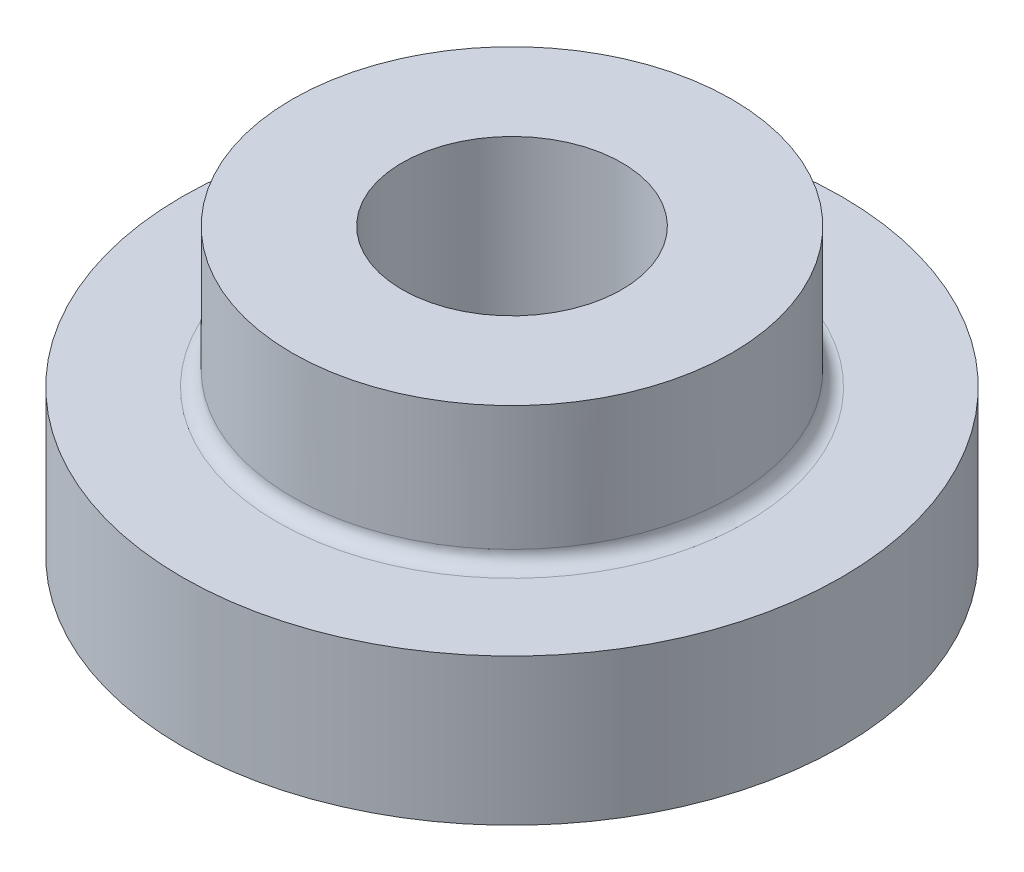
from build123d import *

# Parameters (mm, degrees)
SKETCH1_R                = 3
BOSS_EXTRUDE1_DEPTH      = 2.3
SHELL1_T                 = -1.5
BOSS_EXTRUDE2_DEPTH      = 1.6
BOSS_EXTRUDE2_DEPTH_BACK = 0.4
SKETCH2_R                = 4.5
SKETCH2_R_2              = 3
FILLET4_R                = 0.2


with BuildPart() as part:
    # Sketch1 → Boss-Extrude1 (new body)
    with BuildSketch(Plane(origin=(0, 0, 0), x_dir=(1, 0, 0), z_dir=(0, 1, 0))):
        Circle(SKETCH1_R)
    extrude(amount=BOSS_EXTRUDE1_DEPTH)

    # Shell1
    shell1_openings = [part.faces().sort_by_distance(p)[0] for p in [
        (0, 0, 0),
        (0, 2.3, 0),
    ]]
    offset(amount=SHELL1_T, openings=shell1_openings, kind=Kind.INTERSECTION)

    # Sketch2 → Boss-Extrude2 (add, two sides: drawn at the far end of the back side and taken through both)
    with BuildSketch(Plane.XZ.offset(-BOSS_EXTRUDE2_DEPTH_BACK)):
        Circle(SKETCH2_R)
        Circle(SKETCH2_R_2, mode=Mode.SUBTRACT)
    extrude(amount=BOSS_EXTRUDE2_DEPTH + BOSS_EXTRUDE2_DEPTH_BACK)

    # Fillet4
    fillet4_edges = [part.edges().sort_by_distance(p)[0] for p in [
        (-3, 0, 0),
        (-3, 0.4, 0),
    ]]
    fillet(fillet4_edges, radius=FILLET4_R)


solid = part.part
